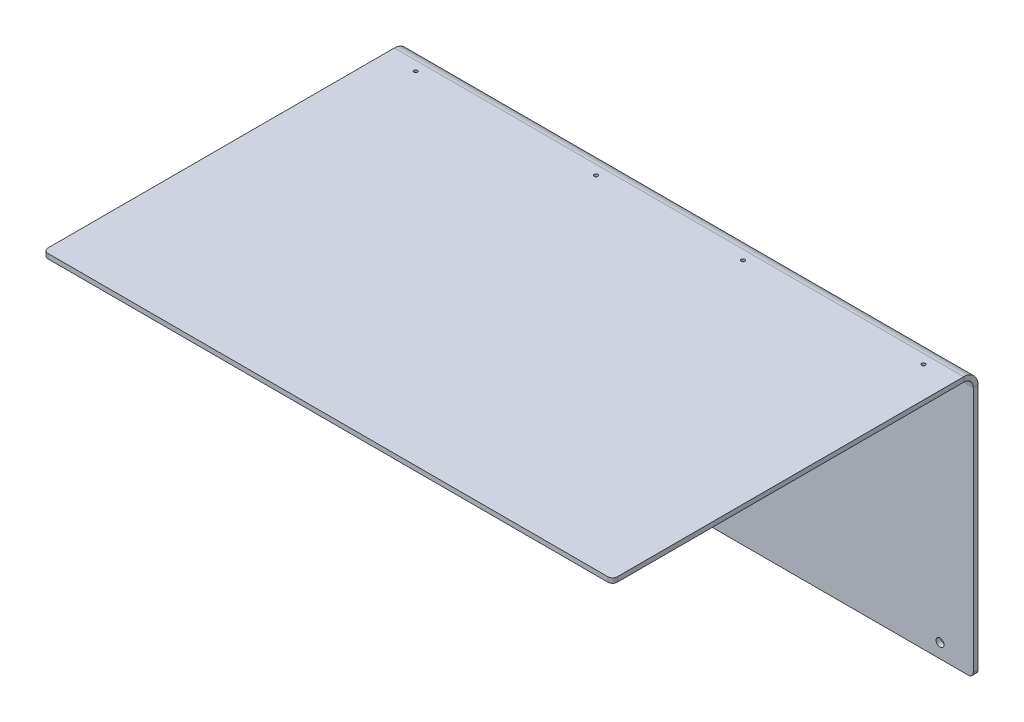
from build123d import *

# Parameters (mm, degrees)
SKETCH1_W                        = 762
SKETCH1_H                        = 349.25
BOSS_EXTRUDE1_DEPTH              = 3.175
EDGE_FLANGE1_STRIP_W             = 50.8
EDGE_FLANGE1_STRIP_H             = 6.35
EDGE_FLANGE1_STRIP_CUT_DEPTH     = 762
EDGE_FLANGE1_DEPTH               = 762
F_27_64_0_42188_DIAMETER_HOLE1_D = 10.715752
F_10_0_1935_DIAMETER_HOLE1_D     = 4.9149
F_10_0_1935_DIAMETER_HOLE2_D     = 4.9149
FILLET1_R                        = 6.35


# Sheet-metal steps are written as plain solids
with BuildPart() as part:
    # Sketch1 → Boss-Extrude1 (new, symmetric)
    with BuildSketch(Plane.XY):
        Rectangle(SKETCH1_W, SKETCH1_H)
    extrude(amount=BOSS_EXTRUDE1_DEPTH, both=True)

    # Edge-Flange1 strip (across the edge) → Edge-Flange1 strip cut (cut)
    with BuildSketch(Plane(origin=(381, 174.625, 3.175), x_dir=(0, -1, 0), z_dir=(-1, 0, 0))):
        with Locations((-12.7, -3.175)):
            Rectangle(EDGE_FLANGE1_STRIP_W, EDGE_FLANGE1_STRIP_H)
    extrude(amount=EDGE_FLANGE1_STRIP_CUT_DEPTH, mode=Mode.SUBTRACT)

    # Edge-Flange1 section (across the edge) → Edge-Flange1 (add)
    with BuildSketch(Plane(origin=(381, 174.625, 3.175), x_dir=(0, -1, 0), z_dir=(-1, 0, 0))):
        with BuildLine():
            Line((-6.35, 12.7), (-6.35, 482.6))
            Line((-6.35, 482.6), (0, 482.6))
            Line((0, 482.6), (0, 12.7))
            ThreePointArc((0, 12.7), (3.719743879, 3.719743879), (12.7, 0))
            Line((12.7, 0), (12.7, -6.35))
            ThreePointArc((12.7, -6.35), (-0.770384182, -0.770384182), (-6.35, 12.7))
        make_face()
    extrude(amount=EDGE_FLANGE1_DEPTH)

    # 27/64 (0.42188) Diameter Hole1 (through all)
    with Locations(Plane(origin=(0, 0, -3.175), x_dir=(-1, 0, 0), z_dir=(0, 0, -1))):
        with Locations((-31.75, -155.575), (336.55, -155.575), (31.75, -155.575), (-336.55, -155.575)):
            Hole(F_27_64_0_42188_DIAMETER_HOLE1_D / 2)

    # #10 (0.1935) Diameter Hole1 (through all)
    with Locations(Plane(origin=(0, 0, -3.175), x_dir=(-1, 0, 0), z_dir=(0, 0, -1))):
        with Locations((-342.9, 149.225), (-114.3, 149.225), (114.3, 149.225), (342.9, 149.225)):
            Hole(F_10_0_1935_DIAMETER_HOLE1_D / 2)

    # #10 (0.1935) Diameter Hole2 (through all)
    with Locations(Plane(origin=(0, 180.975, 0), x_dir=(1, 0, 0), z_dir=(0, 1, 0))):
        with Locations((-339.725, -28.575), (-98.425, -28.575), (98.425, -28.575), (339.725, -28.575)):
            Hole(F_10_0_1935_DIAMETER_HOLE2_D / 2)

    # Fillet1
    fillet1_edges = [part.edges().sort_by_distance(p)[0] for p in [
        (381, 177.8, 485.775),
        (-381, 177.8, 485.775),
        (381, -174.625, 0),
        (-381, -174.625, 0),
    ]]
    fillet(fillet1_edges, radius=FILLET1_R)


solid = part.part
